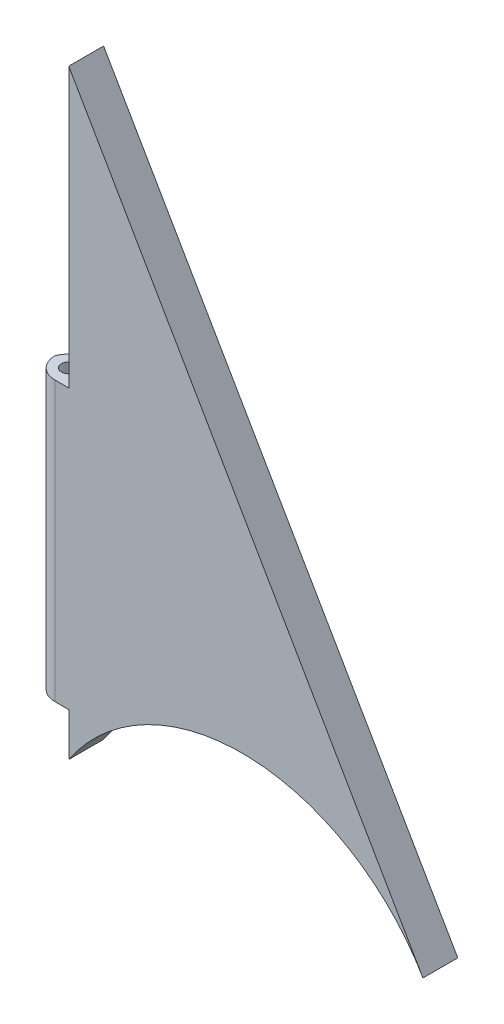
from build123d import *

# Parameters (mm, degrees)
BOSS_EXTRU_1_DEPTH      = 5
ESQUISSE9_W             = 5
ESQUISSE9_H             = 5
BOSS_EXTRU_3_DEPTH      = 40
ESQUISSE12_R            = 1.048820472
ENL_V_MAT_EXTRU_3_DEPTH = 40
CONG_3_R                = 3
CONG_4_R                = 3


with BuildPart() as part:
    # Esquisse1 → Boss.-Extru.1 (new body)
    with BuildSketch(Plane.XY):
        with BuildLine():
            Line((26.025021052, -0.447992933), (-24.829805977, 87.508811894))
            Line((-24.829805977, 87.508811894), (-24.829805977, 1.293439737))
            ThreePointArc((-24.829805977, 1.293439737), (1.080284786, 14.518282983), (26.025021052, -0.447992933))
        make_face()
    extrude(amount=BOSS_EXTRU_1_DEPTH)

    # Esquisse9 → Boss.-Extru.3 (add)
    with BuildSketch(Plane(origin=(0, 47.4898845, 0), x_dir=(1, 0, 0), z_dir=(0, 1, 0))):
        with Locations((-27.329805977, -2.5)):
            Rectangle(ESQUISSE9_W, ESQUISSE9_H)
    extrude(amount=-BOSS_EXTRU_3_DEPTH)

    # Esquisse12 → Enlèv. mat.-Extru.3 (cut)
    with BuildSketch(Plane(origin=(0, 47.4898845, 0), x_dir=(1, 0, 0), z_dir=(0, 1, 0))):
        with Locations(Location((-27.329805977, -2.5, 0), (0, 0, 270))):
            Circle(ESQUISSE12_R)
    extrude(amount=-ENL_V_MAT_EXTRU_3_DEPTH, mode=Mode.SUBTRACT)

    # Congé3
    cong_3_edges = [part.edges().sort_by_distance(p)[0] for p in [
        (-29.829805977, 27.4898845, 5),
    ]]
    fillet(cong_3_edges, radius=CONG_3_R)

    # Congé4
    # the kernel refuses this fillet: 3 mm, written as the material it takes off along each edge
    with BuildSketch(Plane(origin=(-29.829805977, 54.560952312, 0), x_dir=(0, 0, 1), z_dir=(0, -1, 0))) as cong_4_piece_1:
        with BuildLine():
            CenterArc((3, -2.828427125), CONG_4_R, 109.471220634, 70.528779366)
            Line((0, -2.828427125), (-0.06, -2.828427125))
            Line((-0.06, -2.828427125), (-0.06, 0))
            Line((-0.06, 0), (0, 0.06))
            ThreePointArc((0, 0.06), (1, 0.06), (1.98, 0.056568542))
            Line((1.98, 0.056568542), (2, 0))
        make_face()
    extrude(amount=54.142135624, mode=Mode.SUBTRACT)


solid = part.part
